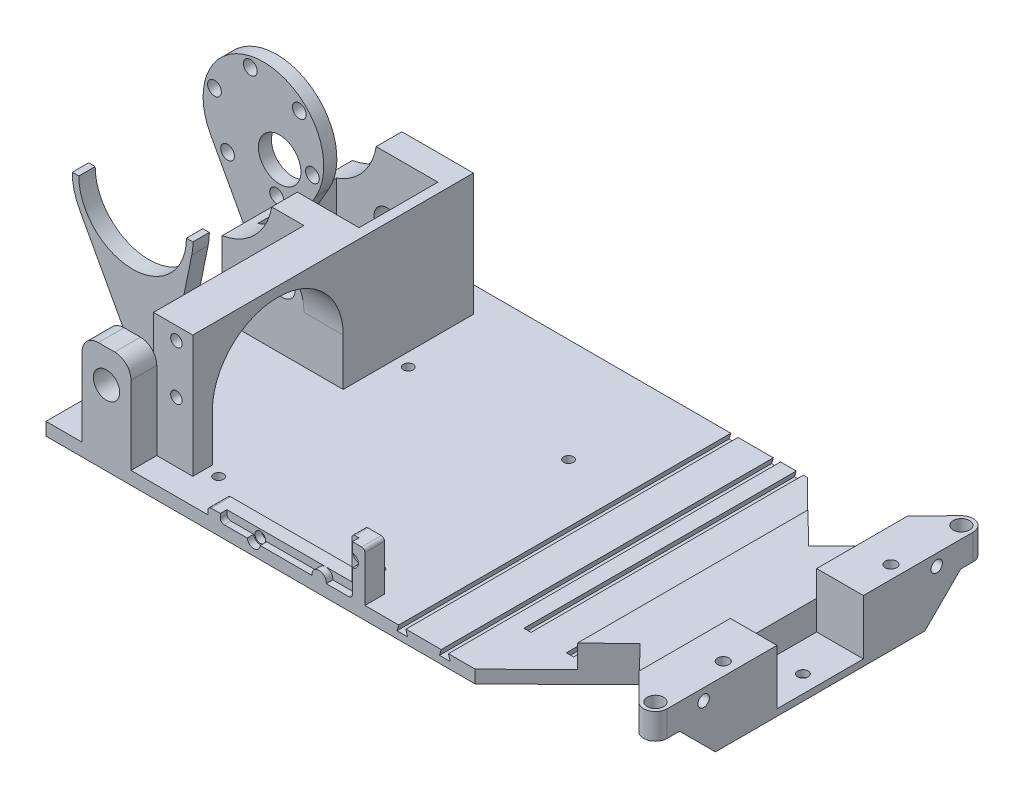
from build123d import *

# Parameters (mm, degrees)
SALIENTE_EXTRUIR1_DEPTH      = 33.55
SALIENTE_EXTRUIR1_DEPTH_BACK = 3.9
CROQUIS2_W                   = 37
CROQUIS2_H                   = 39.8
CROQUIS2_W_2                 = 31
CROQUIS2_H_2                 = 24.1
CROQUIS5_R                   = 3.775
CORTAR_EXTRUIR4_DEPTH        = 56.243936319
CROQUIS6_W                   = 175.41
CROQUIS6_H                   = 101.54
CROQUIS6_W_2                 = 31
CROQUIS6_H_2                 = 24.1
SALIENTE_EXTRUIR4_DEPTH      = 3.935
CROQUIS23_W                  = 28.47
CROQUIS23_H                  = 101.54
SALIENTE_EXTRUIR16_DEPTH     = 7
CORTAR_EXTRUIR15_DEPTH       = 177.033613907
CROQUIS24_4_R                = 2.515
SALIENTE_EXTRUIR23_DEPTH     = 7.87
SALIENTE_EXTRUIR28_DEPTH     = 10.52
CROQUIS41_R                  = 3.775
SALIENTE_EXTRUIR26_DEPTH     = 7.87
CROQUIS50_R                  = 1.75
CORTAR_EXTRUIR26_DEPTH       = 5
CROQUIS51_R                  = 1.75
CORTAR_EXTRUIR27_DEPTH       = 5
CORTAR_EXTRUIR43_REACH       = 195.226
CORTAR_EXTRUIR45_START       = -85.82
CROQUIS91_R                  = 4.025
CORTAR_EXTRUIR45_DEPTH       = 113.847508667
CROQUIS91_2_R                = 4.025
CORTAR_EXTRUIR62_DEPTH       = 7.87
CROQUIS94_R                  = 1.5
CORTAR_EXTRUIR46_DEPTH       = 187.747690816
CORTAR_EXTRUIR47_START       = -101.54
CORTAR_EXTRUIR47_DEPTH       = 83.27
CORTAR_EXTRUIR61_DEPTH       = 199.667508667
CORTAR_EXTRUIR48_START       = 31.95
CROQUIS92_R                  = 18.45
CORTAR_EXTRUIR48_DEPTH       = 224.061171311
SALIENTE_EXTRUIR32_START     = 16.27
CROQUIS92_6_R                = 2.1
CROQUIS92_6_R_2              = 6.5
SALIENTE_EXTRUIR32_DEPTH     = 4
CROQUIS111_W                 = 14.27
CROQUIS111_H                 = 7.87
SALIENTE_EXTRUIR36_DEPTH     = 39.26
CROQUIS99_W                  = 14.47
CROQUIS99_H                  = 26.4
CORTAR_EXTRUIR50_DEPTH       = 16.805
CROQUIS100_R                 = 1.6
CORTAR_EXTRUIR51_DEPTH       = 193.804293808
SALIENTE_EXTRUIR34_START     = 56.27
SALIENTE_EXTRUIR34_DEPTH     = 5
SALIENTE_EXTRUIR35_DEPTH     = 5
CORTAR_EXTRUIR55_DEPTH       = 5
SALIENTE_EXTRUIR38_DEPTH     = 6
CORTAR_EXTRUIR56_DEPTH       = 2
CORTAR_EXTRUIR57_DEPTH       = 4
CROQUIS118_W                 = 12
CROQUIS118_H                 = 6
SALIENTE_EXTRUIR41_DEPTH     = 37.415
CROQUIS119_R                 = 1.75
CORTAR_EXTRUIR60_DEPTH       = 6
CROQUIS120_W                 = 12
CROQUIS120_H                 = 3
SALIENTE_EXTRUIR42_DEPTH     = 40
REDONDEO1_R                  = 20
CROQUIS122_R                 = 0.4
CORTAR_EXTRUIR63_DEPTH       = 10


with BuildPart() as part:
    # Croquis2 → Saliente-Extruir1 (new, two sides: drawn at the far end of the back side and taken through both)
    with BuildSketch(Plane(origin=(0, 0, 0), x_dir=(1, 0, 0), z_dir=(0, 1, 0)).offset(-SALIENTE_EXTRUIR1_DEPTH_BACK)):
        Rectangle(CROQUIS2_W, CROQUIS2_H)
        Rectangle(CROQUIS2_W_2, CROQUIS2_H_2, mode=Mode.SUBTRACT)
    extrude(amount=SALIENTE_EXTRUIR1_DEPTH + SALIENTE_EXTRUIR1_DEPTH_BACK)

    # Croquis5 → Cortar-Extruir4 (cut, through all)
    with BuildSketch(Plane.XY.offset(19.9)):
        with Locations((0, 15)):
            Circle(CROQUIS5_R)
    extrude(amount=-CORTAR_EXTRUIR4_DEPTH, mode=Mode.SUBTRACT)

    # Croquis6 → Saliente-Extruir4 (add)
    with BuildSketch(Plane(origin=(0, -7.8, 0), x_dir=(1, 0, 0), z_dir=(0, 1, 0))):
        with Locations((69.205, -23)):
            Rectangle(CROQUIS6_W, CROQUIS6_H)
        Rectangle(CROQUIS6_W_2, CROQUIS6_H_2, mode=Mode.SUBTRACT)
    extrude(amount=SALIENTE_EXTRUIR4_DEPTH)

    # Croquis23 → Saliente-Extruir16 (add)
    with BuildSketch(Plane(origin=(0, -3.865, 0), x_dir=(1, 0, 0), z_dir=(0, 1, 0))):
        with Locations((142.675, -23)):
            Rectangle(CROQUIS23_W, CROQUIS23_H)
    extrude(amount=SALIENTE_EXTRUIR16_DEPTH)

    # Croquis24 → Cortar-Extruir15 (cut, through all)
    with BuildSketch(Plane(origin=(0, 3.135, 0), x_dir=(1, 0, 0), z_dir=(0, 1, 0))):
        Polygon((138.097567423, -48.77), (128.44, -58.280365372), (128.44, -73.77), (156.91, -73.77), (156.91, -67.873612626), (153.16, -64.065569883), align=None)
        Polygon((128.44, -73.77), (128.44, -58.280365372), (112.710615805, -73.77), align=None)
    cortar_extruir15 = extrude(amount=-CORTAR_EXTRUIR15_DEPTH, mode=Mode.SUBTRACT)

    # Croquis24<4> → Saliente-Extruir23 (add)
    with BuildSketch(Plane(origin=(0, 3.135, 0), x_dir=(1, 0, 0), z_dir=(0, 1, 0))):
        with BuildLine():
            Line((153.16, -42.63), (153.16, -64.065569883))
            Line((153.16, -64.065569883), (161.264942156, -72.295960858))
            ThreePointArc((161.264942156, -72.295960858), (165.194879438, -73.101231622), (167.43, -69.77))
            Line((167.43, -69.77), (167.43, -42.63))
            Line((167.43, -42.63), (153.16, -42.63))
        make_face()
        with Locations(Location((163.83, -69.77, 0), (0, 0, 270))):
            Circle(CROQUIS24_4_R, mode=Mode.SUBTRACT)
    saliente_extruir23 = extrude(amount=SALIENTE_EXTRUIR23_DEPTH)

    # Croquis48 → Saliente-Extruir28 (add)
    with BuildSketch(Plane(origin=(167.43, 0, 0), x_dir=(0, 0, -1), z_dir=(1, 0, 0))):
        Polygon((-65.97, 3.135), (-55.035, -7.8), (-12.1, -7.8), (-12.1, 3.135), align=None)
    saliente_extruir28 = extrude(amount=-SALIENTE_EXTRUIR28_DEPTH)

    # Simetría36: Cortar-Extruir15, Saliente-Extruir23, Saliente-Extruir28 across plane
    add(cortar_extruir15.mirror(Plane.XY.offset(23)), mode=Mode.SUBTRACT)
    add(saliente_extruir23.mirror(Plane.XY.offset(23)))
    add(saliente_extruir28.mirror(Plane.XY.offset(23)))

    # Croquis41 → Saliente-Extruir26 (add)
    with BuildSketch(Plane.XY.offset(73.77)):
        with BuildLine():
            Line((-7.5, 20), (-7.5, -3.865))
            Line((-7.5, -3.865), (7.5, -3.865))
            Line((7.5, -3.865), (7.5, 20))
            ThreePointArc((7.5, 20), (6.035533906, 23.535533906), (2.5, 25))
            Line((2.5, 25), (-2.5, 25))
            ThreePointArc((-2.5, 25), (-6.035533906, 23.535533906), (-7.5, 20))
        make_face()
        with Locations((0, 15)):
            Circle(CROQUIS41_R, mode=Mode.SUBTRACT)
    saliente_extruir26 = extrude(amount=-SALIENTE_EXTRUIR26_DEPTH)

    # Simetría37: Saliente-Extruir26 across plane
    add(saliente_extruir26.mirror(Plane.XY.offset(23)))

    # Croquis50 → Cortar-Extruir26 (cut)
    with BuildSketch(Plane(origin=(0, 11.005, 0), x_dir=(1, 0, 0), z_dir=(0, 1, 0))):
        with Locations(Location((163.43, -48.63, 0), (0, 0, 270))):
            Circle(CROQUIS50_R)
    cortar_extruir26 = extrude(amount=-CORTAR_EXTRUIR26_DEPTH, mode=Mode.SUBTRACT)

    # Croquis51 → Cortar-Extruir27 (cut)
    with BuildSketch(Plane(origin=(167.43, 0, 0), x_dir=(0, 0, -1), z_dir=(1, 0, 0))):
        with Locations((-58.63, 7.505)):
            Circle(CROQUIS51_R)
    cortar_extruir27 = extrude(amount=-CORTAR_EXTRUIR27_DEPTH, mode=Mode.SUBTRACT)

    # Simetría38: Cortar-Extruir26, Cortar-Extruir27 across plane
    add(cortar_extruir26.mirror(Plane.XY.offset(23)), mode=Mode.SUBTRACT)
    add(cortar_extruir27.mirror(Plane.XY.offset(23)), mode=Mode.SUBTRACT)

    # Croquis87 → Cortar-Extruir43 (cut, up to next)
    with BuildSketch(Plane(origin=(156.91, 0, 0), x_dir=(0, 0, -1), z_dir=(1, 0, 0)), mode=Mode.PRIVATE) as cortar_extruir43_sk1:
        Polygon((-67.873612626, -7.8), (-55.035, -7.8), (-65.97, 3.135), (-67.873612626, 3.135), align=None)
    cortar_extruir43_tool1 = extrude(cortar_extruir43_sk1.sketch, amount=-CORTAR_EXTRUIR43_REACH, mode=Mode.PRIVATE) & part.part
    # Croquis87 → Cortar-Extruir43 (cut, up to next)
    with BuildSketch(Plane(origin=(156.91, 0, 0), x_dir=(0, 0, -1), z_dir=(1, 0, 0)), mode=Mode.PRIVATE) as cortar_extruir43_sk2:
        Polygon((19.97, 3.135), (9.035, -7.8), (21.873612626, -7.8), (21.873612626, 3.135), align=None)
    cortar_extruir43_tool2 = extrude(cortar_extruir43_sk2.sketch, amount=-CORTAR_EXTRUIR43_REACH, mode=Mode.PRIVATE) & part.part
    add(cortar_extruir43_tool1.solids().sort_by_distance((156.91, -3.684334, 63.512139))[0], mode=Mode.SUBTRACT)
    add(cortar_extruir43_tool2.solids().sort_by_distance((156.91, -3.684334, -17.512139))[0], mode=Mode.SUBTRACT)

    # Croquis91 → Cortar-Extruir45 (cut, through all)
    with BuildSketch(Plane.XY.offset(73.77).offset(CORTAR_EXTRUIR45_START)):
        with Locations(Location((0, 15, 0), (0, 0, 180))):
            Circle(CROQUIS91_R)
    extrude(amount=-CORTAR_EXTRUIR45_DEPTH, mode=Mode.SUBTRACT)

    # Croquis91<2> → Cortar-Extruir62 (cut)
    with BuildSketch(Plane.XY.offset(73.77)):
        with Locations(Location((0, 15, 0), (0, 0, 180))):
            Circle(CROQUIS91_2_R)
    extrude(amount=-CORTAR_EXTRUIR62_DEPTH, mode=Mode.SUBTRACT)

    # Croquis94 → Cortar-Extruir46 (cut, through all)
    with BuildSketch(Plane(origin=(0, -3.865, 0), x_dir=(1, 0, 0), z_dir=(0, 1, 0))):
        with Locations(Location((22.5, -4, 0), (0, 0, 270))):
            Circle(CROQUIS94_R)
        with Locations(Location((22.5, -62, 0), (0, 0, 270))):
            Circle(CROQUIS94_R)
        with Locations(Location((71.5, -4, 0), (0, 0, 270))):
            Circle(CROQUIS94_R)
        with Locations(Location((71.5, -62, 0), (0, 0, 270))):
            Circle(CROQUIS94_R)
    extrude(amount=-CORTAR_EXTRUIR46_DEPTH, mode=Mode.SUBTRACT)

    # Croquis95 → Cortar-Extruir47 (cut)
    with BuildSketch(Plane.XY.offset(73.77).offset(CORTAR_EXTRUIR47_START)):
        Polygon((112.060282592, -5.655), (108.819717408, -5.655), (109.372658585, -3.775), (111.507341415, -3.775), align=None)
        Polygon((125.060282592, -5.655), (121.819717408, -5.655), (122.372658585, -3.775), (124.507341415, -3.775), align=None)
    extrude(amount=CORTAR_EXTRUIR47_DEPTH, mode=Mode.SUBTRACT)

    # Croquis95<3> → Cortar-Extruir61 (cut, through all)
    with BuildSketch(Plane.XY.offset(73.77)):
        Polygon((92.060282592, -5.655), (88.819717408, -5.655), (89.372658585, -3.775), (91.507341415, -3.775), align=None)
        Polygon((105.060282592, -5.655), (101.819717408, -5.655), (102.372658585, -3.775), (104.507341415, -3.775), align=None)
    extrude(amount=-CORTAR_EXTRUIR61_DEPTH, mode=Mode.SUBTRACT)

    # Croquis92 → Cortar-Extruir48 (cut, through all)
    with BuildSketch(Plane.XY.offset(-12.05).offset(CORTAR_EXTRUIR48_START)):
        with Locations((-21.566756826, 36.566756826)):
            Circle(CROQUIS92_R)
    extrude(amount=-CORTAR_EXTRUIR48_DEPTH, mode=Mode.SUBTRACT)

    # Croquis92<6> → Saliente-Extruir32 (add)
    with BuildSketch(Plane.XY.offset(-12.05).offset(SALIENTE_EXTRUIR32_START)):
        with BuildLine():
            Line((-37.786340615, 27.773145411), (-18.5, -7.8))
            Line((-18.5, -7.8), (-18.5, 18.373420063))
            ThreePointArc((-18.5, 18.373420063), (-16.983829314, 18.695011656), (-15.5, 19.142722804))
            Line((-15.5, 19.142722804), (-15.5, 10.135))
            Line((-15.5, 10.135), (-5.579381534, 27.35772152))
            ThreePointArc((-5.579381534, 27.35772152), (-21.328797904, 55.015222224), (-37.786340615, 27.773145411))
        make_face()
        with Locations((-10.606601718, 47.526911935)):
            Circle(CROQUIS92_6_R, mode=Mode.SUBTRACT)
        with Locations((-17.555061627, 21.594906519)):
            Circle(CROQUIS92_6_R, mode=Mode.SUBTRACT)
        with Locations((-32.526911935, 25.606601718)):
            Circle(CROQUIS92_6_R, mode=Mode.SUBTRACT)
        with Locations((-36.538607134, 40.578452025)):
            Circle(CROQUIS92_6_R, mode=Mode.SUBTRACT)
        with Locations((-25.578452025, 51.538607134)):
            Circle(CROQUIS92_6_R, mode=Mode.SUBTRACT)
        with Locations((-16.617009358, 31.617009358)):
            Circle(CROQUIS92_6_R_2, mode=Mode.SUBTRACT)
        with Locations((-6.594906519, 32.555061627)):
            Circle(CROQUIS92_6_R, mode=Mode.SUBTRACT)
    extrude(amount=-SALIENTE_EXTRUIR32_DEPTH)

    # Croquis111 → Saliente-Extruir36 (add)
    with BuildSketch(Plane.XY.offset(3.37)):
        with Locations((160.295, 7.07)):
            Rectangle(CROQUIS111_W, CROQUIS111_H)
    extrude(amount=SALIENTE_EXTRUIR36_DEPTH)

    # Croquis99 → Cortar-Extruir50 (cut)
    with BuildSketch(Plane(origin=(0, 11.005, 0), x_dir=(1, 0, 0), z_dir=(0, 1, 0))):
        with Locations((160.395, -23)):
            Rectangle(CROQUIS99_W, CROQUIS99_H)
    extrude(amount=-CORTAR_EXTRUIR50_DEPTH, mode=Mode.SUBTRACT)

    # Croquis100 → Cortar-Extruir51 (cut, through all)
    with BuildSketch(Plane(origin=(0, -5.8, 0), x_dir=(1, 0, 0), z_dir=(0, 1, 0))):
        with Locations(Location((162.17, -23, 0), (0, 0, 270))):
            Circle(CROQUIS100_R)
    extrude(amount=-CORTAR_EXTRUIR51_DEPTH, mode=Mode.SUBTRACT)

    # Croquis92<7> → Saliente-Extruir34 (add)
    with BuildSketch(Plane.XY.offset(-12.05).offset(SALIENTE_EXTRUIR34_START)):
        with BuildLine():
            Line((-37.786340615, 27.773145411), (-18.5, -7.8))
            Line((-18.5, -7.8), (-18.5, 18.373420063))
            ThreePointArc((-18.5, 18.373420063), (-13.483569124, 53.151827721), (-37.786340615, 27.773145411))
        make_face()
    extrude(amount=-SALIENTE_EXTRUIR34_DEPTH)

    # Croquis109 → Saliente-Extruir35 (add)
    with BuildSketch(Plane.XY.offset(44.22)):
        with BuildLine():
            Line((-11, -3.865), (-3.490544997, 32.871751291))
            ThreePointArc((-3.490544997, 32.871751291), (-8.748539985, 23.296646917), (-18.5, 18.373420063))
            Line((-18.5, 18.373420063), (-18.5, -3.865))
            Line((-18.5, -3.865), (-11, -3.865))
        make_face()
    extrude(amount=-SALIENTE_EXTRUIR35_DEPTH)

    # Croquis109<3> → Cortar-Extruir55 (cut)
    with BuildSketch(Plane.XY.offset(44.22)):
        with BuildLine():
            Line((-40.016756826, 36.566756826), (-38.016756826, 36.566756826))
            ThreePointArc((-38.016756826, 36.566756826), (-21.566756826, 20.116756826), (-5.116756826, 36.566756826))
            Line((-5.116756826, 36.566756826), (-3.116756826, 36.566756826))
            ThreePointArc((-3.116756826, 36.566756826), (-21.566756826, 55.016756826), (-40.016756826, 36.566756826))
        make_face()
    extrude(amount=-CORTAR_EXTRUIR55_DEPTH, mode=Mode.SUBTRACT)

    # Croquis114 → Saliente-Extruir38 (add)
    with BuildSketch(Plane.XY.offset(73.77)):
        with BuildLine():
            Line((79, -3.865), (79, 10.135))
            ThreePointArc((79, 10.135), (78.707106781, 10.842106781), (78, 11.135))
            Line((78, 11.135), (74, 11.135))
            ThreePointArc((74, 11.135), (73.292893219, 10.842106781), (73, 10.135))
            Line((73, 10.135), (73, -1.6))
            Line((73, -1.6), (32, -1.6))
            ThreePointArc((32, -1.6), (31.292893219, -1.892893219), (31, -2.6))
            Line((31, -2.6), (31, -3.865))
            Line((31, -3.865), (79, -3.865))
        make_face()
    extrude(amount=-SALIENTE_EXTRUIR38_DEPTH)

    # Croquis114<3> → Cortar-Extruir56 (cut)
    with BuildSketch(Plane.XY.offset(73.77)):
        with BuildLine():
            Line((46.989974874, 16.4), (62.80910977, 16.4))
            ThreePointArc((62.80910977, 16.4), (65, 14), (67.19089023, 16.4))
            Line((67.19089023, 16.4), (74, 16.4))
            ThreePointArc((74, 16.4), (74.848528137, 16.048528137), (75.2, 15.2))
            Line((75.2, 15.2), (75.2, 8.189974874))
            ThreePointArc((75.2, 8.189974874), (77, 6.2), (75.2, 4.210025126))
            Line((75.2, 4.210025126), (75.2, -2.8))
            ThreePointArc((75.2, -2.8), (74.848528137, -3.648528137), (74, -4))
            Line((74, -4), (67.19089023, -4))
            ThreePointArc((67.19089023, -4), (65, -1.6), (62.80910977, -4))
            Line((62.80910977, -4), (46.989974874, -4))
            ThreePointArc((46.989974874, -4), (45, -5.8), (43.010025126, -4))
            Line((43.010025126, -4), (36, -4))
            ThreePointArc((36, -4), (35.151471863, -3.648528137), (34.8, -2.8))
            Line((34.8, -2.8), (34.8, 4.00910977))
            ThreePointArc((34.8, 4.00910977), (37.2, 6.2), (34.8, 8.39089023))
            Line((34.8, 8.39089023), (34.8, 15.2))
            ThreePointArc((34.8, 15.2), (35.151471863, 16.048528137), (36, 16.4))
            Line((36, 16.4), (43.010025126, 16.4))
            ThreePointArc((43.010025126, 16.4), (45, 18.2), (46.989974874, 16.4))
        make_face()
    extrude(amount=-CORTAR_EXTRUIR56_DEPTH, mode=Mode.SUBTRACT)

    # Croquis114<4> → Cortar-Extruir57 (cut)
    with BuildSketch(Plane.XY.offset(73.77)):
        with BuildLine():
            Line((46.598679142, -3.865), (43.401320858, -3.865))
            ThreePointArc((43.401320858, -3.865), (45, -5.4), (46.598679142, -3.865))
        make_face()
        with BuildLine():
            ThreePointArc((46.6, -3.8), (45, -2.2), (43.4, -3.8))
            Line((43.4, -3.8), (46.6, -3.8))
        make_face()
        with BuildLine():
            ThreePointArc((75, 7.8), (73.4, 6.2), (75, 4.6))
            Line((75, 4.6), (75, 7.8))
        make_face()
        with BuildLine():
            Line((75, 7.8), (75, 4.6))
            ThreePointArc((75, 4.6), (76.13137085, 5.06862915), (76.6, 6.2))
            ThreePointArc((76.6, 6.2), (76.13137085, 7.33137085), (75, 7.8))
        make_face()
        with BuildLine():
            ThreePointArc((43.4, -3.8), (43.400330249, -3.83250671), (43.401320858, -3.865))
            Line((43.401320858, -3.865), (46.598679142, -3.865))
            ThreePointArc((46.598679142, -3.865), (46.599669751, -3.83250671), (46.6, -3.8))
            Line((46.6, -3.8), (43.4, -3.8))
        make_face()
    extrude(amount=-CORTAR_EXTRUIR57_DEPTH, mode=Mode.SUBTRACT)

    # Croquis118 → Saliente-Extruir41 (add)
    with BuildSketch(Plane(origin=(0, -3.865, 0), x_dir=(1, 0, 0), z_dir=(0, 1, 0))):
        with Locations((12.5, -62.9)):
            Rectangle(CROQUIS118_W, CROQUIS118_H)
    extrude(amount=SALIENTE_EXTRUIR41_DEPTH)

    # Croquis119 → Cortar-Extruir60 (cut)
    with BuildSketch(Plane.XY.offset(65.9)):
        with Locations((13.5, 29.55)):
            Circle(CROQUIS119_R)
        with Locations((13.5, 14.55)):
            Circle(CROQUIS119_R)
    cortar_extruir60 = extrude(amount=-CORTAR_EXTRUIR60_DEPTH, mode=Mode.SUBTRACT)

    # Simetría39: Cortar-Extruir60 across plane
    add(cortar_extruir60.mirror(Plane.XY.offset(23)), mode=Mode.SUBTRACT)

    # Croquis120 → Saliente-Extruir42 (add)
    with BuildSketch(Plane(origin=(0, 0, 59.9), x_dir=(-1, 0, 0), z_dir=(0, 0, -1))):
        with Locations((-12.5, 32.05)):
            Rectangle(CROQUIS120_W, CROQUIS120_H)
    extrude(amount=SALIENTE_EXTRUIR42_DEPTH)

    # Redondeo1
    # the kernel refuses this fillet: 20 mm, written as the material it adds along each edge
    with BuildSketch(Plane(origin=(6.5, 30.55, 59.9), x_dir=(0, 0, -1), z_dir=(1, 0, 0))) as redondeo1_piece_1_section:
        with BuildLine():
            CenterArc((REDONDEO1_R, -REDONDEO1_R), REDONDEO1_R, 90, 90)
            Line((0, -REDONDEO1_R), (0, 0))
            Line((0, 0), (REDONDEO1_R, 0))
        make_face()
    redondeo1_piece_1 = extrude(amount=55.563859338, mode=Mode.PRIVATE)
    redondeo1_piece_1 = redondeo1_piece_1 - Plane(origin=(13.5, 29.55, 55.78969218), x_dir=(1, 0, 0), z_dir=(0, 0, 1)) * Cylinder(1.75, 192, mode=Mode.PRIVATE)
    redondeo1_piece_1 = redondeo1_piece_1 - Plane(origin=(13.5, 14.55, 55.78969218), x_dir=(1, 0, 0), z_dir=(0, 0, 1)) * Cylinder(1.75, 192, mode=Mode.PRIVATE)
    redondeo1_piece_1 = split(redondeo1_piece_1, bisect_by=Plane(origin=(18.5, 25.70321169, 55.78969218), z_dir=(-1, 0, 0)), keep=Keep.TOP, mode=Mode.PRIVATE)
    add(redondeo1_piece_1)
    with BuildSketch(Plane(origin=(6.5, 30.55, 19.9), x_dir=(0, -1, 0), z_dir=(1, 0, 0))) as redondeo1_piece_2:
        with BuildLine():
            CenterArc((REDONDEO1_R, -REDONDEO1_R), REDONDEO1_R, 90, 90)
            Line((0, -REDONDEO1_R), (0, 0))
            Line((0, 0), (REDONDEO1_R, 0))
        make_face()
    extrude(amount=12)

    # Croquis122 → Cortar-Extruir63 (cut)
    with BuildSketch(Plane(origin=(0, 0, -27.77), x_dir=(-1, 0, 0), z_dir=(0, 0, -1))):
        with Locations((-66.12, -5.8325)):
            Circle(CROQUIS122_R)
        with Locations((-63.58, -5.8325)):
            Circle(CROQUIS122_R)
        with Locations((-61.04, -5.8325)):
            Circle(CROQUIS122_R)
        with Locations((-58.5, -5.8325)):
            Circle(CROQUIS122_R)
    extrude(amount=-CORTAR_EXTRUIR63_DEPTH, mode=Mode.SUBTRACT)


solid = part.part
